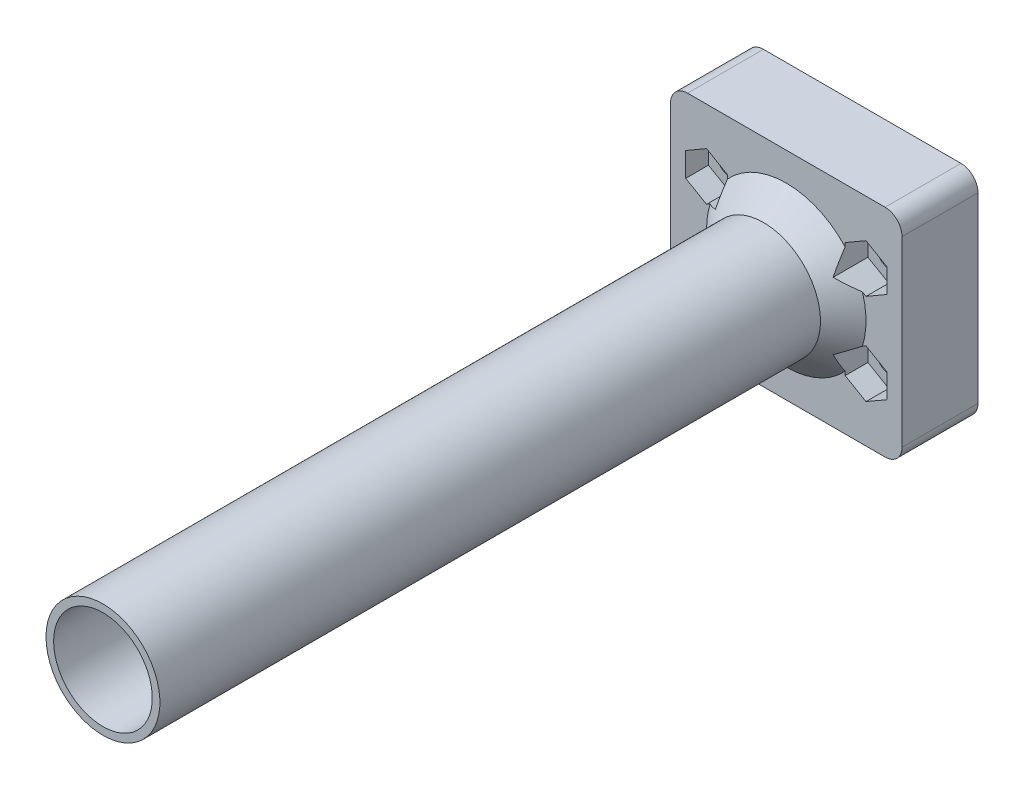
from build123d import *

# Parameters (mm, degrees)
SKETCH1_R           = 1.5
BOSS_EXTRUDE1_DEPTH = 10
CUT_EXTRUDE2_DEPTH  = 3
SKETCH3_R           = 7.5
SKETCH3_R_2         = 6.5
BOSS_EXTRUDE2_DEPTH = 90
CHAMFER1_SIZE       = 3


with BuildPart() as part:
    # Sketch1 → Boss-Extrude1 (new body)
    with BuildSketch(Plane.XY):
        with BuildLine():
            Line((-13.009713205, 28.5), (13.009713205, 28.5))
            ThreePointArc((13.009713205, 28.5), (14.59383519, 27.84383519), (15.25, 26.259713205))
            Line((15.25, 26.259713205), (15.25, 2.240286795))
            ThreePointArc((15.25, 2.240286795), (14.59383519, 0.65616481), (13.009713205, 0))
            Line((13.009713205, 0), (-13.009713205, 0))
            ThreePointArc((-13.009713205, 0), (-14.59383519, 0.65616481), (-15.25, 2.240286795))
            Line((-15.25, 2.240286795), (-15.25, 26.259713205))
            ThreePointArc((-15.25, 26.259713205), (-14.59383519, 27.84383519), (-13.009713205, 28.5))
        make_face()
        with Locations((-10.5, 20.25)):
            Circle(SKETCH1_R, mode=Mode.SUBTRACT)
        with Locations((10.5, 20.25)):
            Circle(SKETCH1_R, mode=Mode.SUBTRACT)
        with Locations((10.5, 8.25)):
            Circle(SKETCH1_R, mode=Mode.SUBTRACT)
        with Locations((-10.5, 8.25)):
            Circle(SKETCH1_R, mode=Mode.SUBTRACT)
    extrude(amount=BOSS_EXTRUDE1_DEPTH)

    # Sketch2 → Cut-Extrude2 (cut)
    with BuildSketch(Plane.XY.offset(10)):
        Polygon((-10.5, 23.425426481), (-13.25, 21.83771324), (-13.25, 18.66228676), (-10.5, 17.074573519), (-7.75, 18.66228676), (-7.75, 21.83771324), align=None)
        Polygon((-10.5, 11.425426481), (-13.25, 9.83771324), (-13.25, 6.66228676), (-10.5, 5.074573519), (-7.75, 6.66228676), (-7.75, 9.83771324), align=None)
        Polygon((10.5, 23.425426481), (7.75, 21.83771324), (7.75, 18.66228676), (10.5, 17.074573519), (13.25, 18.66228676), (13.25, 21.83771324), align=None)
        Polygon((10.5, 11.425426481), (7.75, 9.83771324), (7.75, 6.66228676), (10.5, 5.074573519), (13.25, 6.66228676), (13.25, 9.83771324), align=None)
    extrude(amount=-CUT_EXTRUDE2_DEPTH, mode=Mode.SUBTRACT)

    # Sketch3 → Boss-Extrude2 (add)
    with BuildSketch(Plane.XY.offset(10)):
        with Locations(Location((0, 14.25, 0), (0, 0, 180))):
            Circle(SKETCH3_R)
        with Locations(Location((0, 14.25, 0), (0, 0, 180))):
            Circle(SKETCH3_R_2, mode=Mode.SUBTRACT)
    extrude(amount=BOSS_EXTRUDE2_DEPTH)

    # Chamfer1
    # the kernel refuses this chamfer: 3 mm, written as the material it adds along each edge
    with BuildSketch(Plane(origin=(0, 14.25, 10), x_dir=(-1, 0, 0), z_dir=(0, 1, 0))) as chamfer1_piece_1_section:
        Polygon((7.5 + CHAMFER1_SIZE, 0), (7.5, CHAMFER1_SIZE), (7.5, 0), align=None)
    chamfer1_piece_1 = revolve(axis=Axis((0, 14.25, 10), (0, 0, 1)), mode=Mode.PRIVATE)
    chamfer1_piece_1 = split(chamfer1_piece_1, bisect_by=Plane(origin=(7.75, 14.25, 10.835375001), z_dir=(-1, 0, 0)), keep=Keep.TOP, mode=Mode.PRIVATE)
    chamfer1_piece_1 = split(chamfer1_piece_1, bisect_by=Plane(origin=(-10.27932295, 11.298018527, 10.835375001), z_dir=(0.4999999999999999, 0.8660254037844388, 0)), keep=Keep.TOP, mode=Mode.PRIVATE)
    chamfer1_piece_1 = split(chamfer1_piece_1, bisect_by=Plane(origin=(-10.27932295, 17.201981474, 10.835375001), z_dir=(0.5000000000000004, -0.8660254037844384, 0)), keep=Keep.TOP, mode=Mode.PRIVATE)
    add(chamfer1_piece_1)
    with BuildSketch(Plane(origin=(0, 14.25, 10), x_dir=(-1, 0, 0), z_dir=(0, 1, 0))) as chamfer1_piece_2_section:
        Polygon((7.5 + CHAMFER1_SIZE, 0), (7.5, CHAMFER1_SIZE), (7.5, 0), align=None)
    chamfer1_piece_2 = revolve(axis=Axis((0, 14.25, 10), (0, 0, 1)), mode=Mode.PRIVATE)
    chamfer1_piece_2 = split(chamfer1_piece_2, bisect_by=Plane(origin=(7.75, 21.633797899, 10.850650839), z_dir=(-1, 0, 0)), keep=Keep.TOP, mode=Mode.PRIVATE)
    chamfer1_piece_2 = split(chamfer1_piece_2, bisect_by=Plane(origin=(-7.75, 21.633797899, 10.850650839), z_dir=(1, 0, 0)), keep=Keep.TOP, mode=Mode.PRIVATE)
    add(chamfer1_piece_2)
    with BuildSketch(Plane(origin=(0, 14.25, 10), x_dir=(-1, 0, 0), z_dir=(0, 1, 0))) as chamfer1_piece_3_section:
        Polygon((7.5 + CHAMFER1_SIZE, 0), (7.5, CHAMFER1_SIZE), (7.5, 0), align=None)
    chamfer1_piece_3 = revolve(axis=Axis((0, 14.25, 10), (0, 0, 1)), mode=Mode.PRIVATE)
    chamfer1_piece_3 = split(chamfer1_piece_3, bisect_by=Plane(origin=(10.279322953, 11.298018528, 10.835374999), z_dir=(-0.5000000000000011, 0.866025403784438, 0)), keep=Keep.TOP, mode=Mode.PRIVATE)
    chamfer1_piece_3 = split(chamfer1_piece_3, bisect_by=Plane(origin=(-7.75, 14.25, 10.835374999), z_dir=(1, 0, 0)), keep=Keep.TOP, mode=Mode.PRIVATE)
    chamfer1_piece_3 = split(chamfer1_piece_3, bisect_by=Plane(origin=(10.279322953, 17.201981472, 10.835374999), z_dir=(-0.49999999999999445, -0.8660254037844419, 0)), keep=Keep.TOP, mode=Mode.PRIVATE)
    add(chamfer1_piece_3)


solid = part.part
